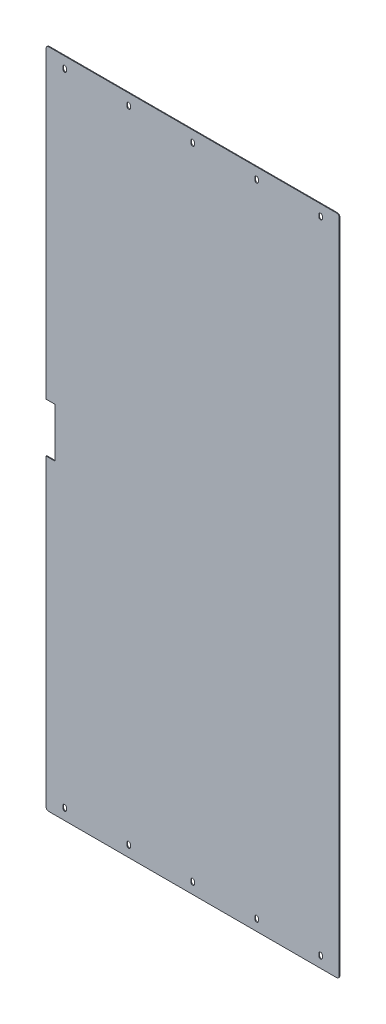
from build123d import *

# Parameters (mm, degrees)
SKETCH_1_W             = 595
SKETCH_1_H             = 1345
SM_BASE_FLANGE_1_DEPTH = 1.5
FILLET_1_R             = 5
CUT_EXTRUDE_1_DEPTH    = 10
PATTERN_LINEAR_1_COUNT = 5
PATTERN_LINEAR_1_PITCH = 130
SKETCH_3_W             = 18
SKETCH_3_H             = 100
CUT_EXTRUDE_2_DEPTH    = 10


# Sheet-metal steps are written as plain solids
with BuildPart() as part:
    # Sketch 1 → 基体-法兰1 (new body)
    with BuildSketch(Plane.XY):
        Rectangle(SKETCH_1_W, SKETCH_1_H)
    extrude(amount=-SM_BASE_FLANGE_1_DEPTH)

    # 圆角1
    fillet_1_edges = [part.edges().sort_by_distance(p)[0] for p in [
        (-297.5, 672.5, -0.75),
        (297.5, 672.5, -0.75),
        (297.5, -672.5, -0.75),
        (-297.5, -672.5, -0.75),
    ]]
    fillet(fillet_1_edges, radius=FILLET_1_R)

    # Sketch 2 → 切除-拉伸1 (cut)
    with BuildSketch(Plane.XY):
        with BuildLine():
            Line((-263.5, 647.5), (-263.5, 652.5))
            ThreePointArc((-263.5, 652.5), (-260, 656), (-256.5, 652.5))
            Line((-256.5, 652.5), (-256.5, 647.5))
            ThreePointArc((-256.5, 647.5), (-260, 644), (-263.5, 647.5))
        make_face()
        with BuildLine():
            Line((-263.5, -652.5), (-263.5, -647.5))
            ThreePointArc((-263.5, -647.5), (-260, -644), (-256.5, -647.5))
            Line((-256.5, -647.5), (-256.5, -652.5))
            ThreePointArc((-256.5, -652.5), (-260, -656), (-263.5, -652.5))
        make_face()
    cut_extrude_1 = extrude(amount=-CUT_EXTRUDE_1_DEPTH, mode=Mode.SUBTRACT)

    # 阵列(线性)1: 切除-拉伸1 ×5
    with Locations(*[(i * PATTERN_LINEAR_1_PITCH, 0, 0) for i in range(1, PATTERN_LINEAR_1_COUNT)]):
        add(cut_extrude_1, mode=Mode.SUBTRACT)

    # 草图3 → 切除-拉伸2 (cut)
    with BuildSketch(Plane(origin=(0, 0, -1.5), x_dir=(-1, 0, 0), z_dir=(0, 0, -1))):
        with Locations((288.5, 0)):
            Rectangle(SKETCH_3_W, SKETCH_3_H)
    extrude(amount=-CUT_EXTRUDE_2_DEPTH, mode=Mode.SUBTRACT)


solid = part.part
